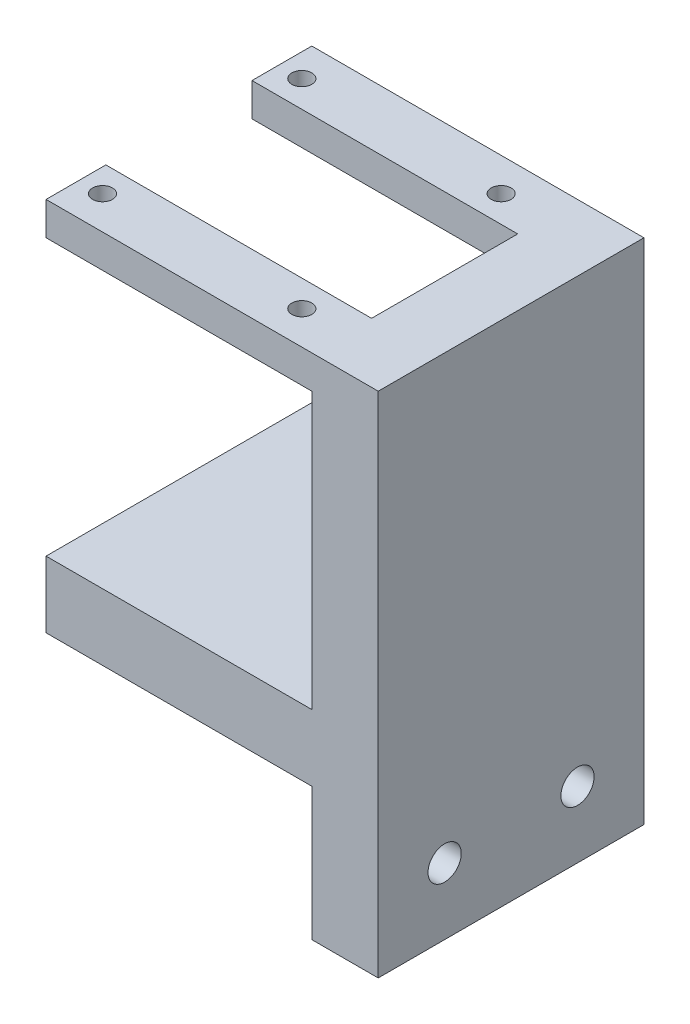
from build123d import *

# Parameters (mm, degrees)
SKETCH1_W           = 40
SKETCH1_H           = 76.5
SKETCH1_R           = 2.5
BOSS_EXTRUDE1_DEPTH = 10
SKETCH3_W           = 40
SKETCH3_H           = 10
BOSS_EXTRUDE2_DEPTH = 40
SKETCH4_W           = 9
SKETCH4_H           = 5
BOSS_EXTRUDE3_DEPTH = 40
CUT_EXTRUDE1_REACH  = 90.613
SKETCH5_R           = 1.5


with BuildPart() as part:
    # Sketch1 → Boss-Extrude1 (new body)
    with BuildSketch(Plane(origin=(0, 0, 0), x_dir=(0, 0, -1), z_dir=(1, 0, 0))):
        with Locations((0, 18.25)):
            Rectangle(SKETCH1_W, SKETCH1_H)
        with Locations((10, -10)):
            Circle(SKETCH1_R, mode=Mode.SUBTRACT)
        with Locations((-10, -10)):
            Circle(SKETCH1_R, mode=Mode.SUBTRACT)
    extrude(amount=BOSS_EXTRUDE1_DEPTH)

    # Sketch3 → Boss-Extrude2 (add)
    with BuildSketch(Plane.ZY):
        with Locations((0, 5)):
            Rectangle(SKETCH3_W, SKETCH3_H)
    extrude(amount=BOSS_EXTRUDE2_DEPTH)

    # Sketch4 → Boss-Extrude3 (add)
    with BuildSketch(Plane.ZY):
        with Locations((-15.5, 54)):
            Rectangle(SKETCH4_W, SKETCH4_H)
    boss_extrude3 = extrude(amount=BOSS_EXTRUDE3_DEPTH)

    # Sketch5 → Cut-Extrude1 (cut, up to next)
    with BuildSketch(Plane(origin=(0, 56.5, 0), x_dir=(1, 0, 0), z_dir=(0, 1, 0)), mode=Mode.PRIVATE) as cut_extrude1_sk1:
        with Locations((-36.5, 15)):
            Circle(SKETCH5_R)
    cut_extrude1_tool1 = extrude(cut_extrude1_sk1.sketch, amount=-CUT_EXTRUDE1_REACH, mode=Mode.PRIVATE) & part.part
    # Sketch5 → Cut-Extrude1 (cut, up to next)
    with BuildSketch(Plane(origin=(0, 56.5, 0), x_dir=(1, 0, 0), z_dir=(0, 1, 0)), mode=Mode.PRIVATE) as cut_extrude1_sk2:
        with Locations((-6.5, 15)):
            Circle(SKETCH5_R)
    cut_extrude1_tool2 = extrude(cut_extrude1_sk2.sketch, amount=-CUT_EXTRUDE1_REACH, mode=Mode.PRIVATE) & part.part
    cut_extrude1_1 = cut_extrude1_tool1.solids().sort_by_distance((-36.5, 56.5, -15))[0]
    add(cut_extrude1_1, mode=Mode.SUBTRACT)
    cut_extrude1_2 = cut_extrude1_tool2.solids().sort_by_distance((-6.5, 56.5, -15))[0]
    add(cut_extrude1_2, mode=Mode.SUBTRACT)
    cut_extrude1 = cut_extrude1_1 + cut_extrude1_2  # Cut-Extrude1 as one shape, for the pattern or mirror that repeats it

    # Mirror2: Boss-Extrude3, Cut-Extrude1 across plane
    add(boss_extrude3.mirror(Plane.XY))
    add(cut_extrude1.mirror(Plane.XY), mode=Mode.SUBTRACT)


solid = part.part
